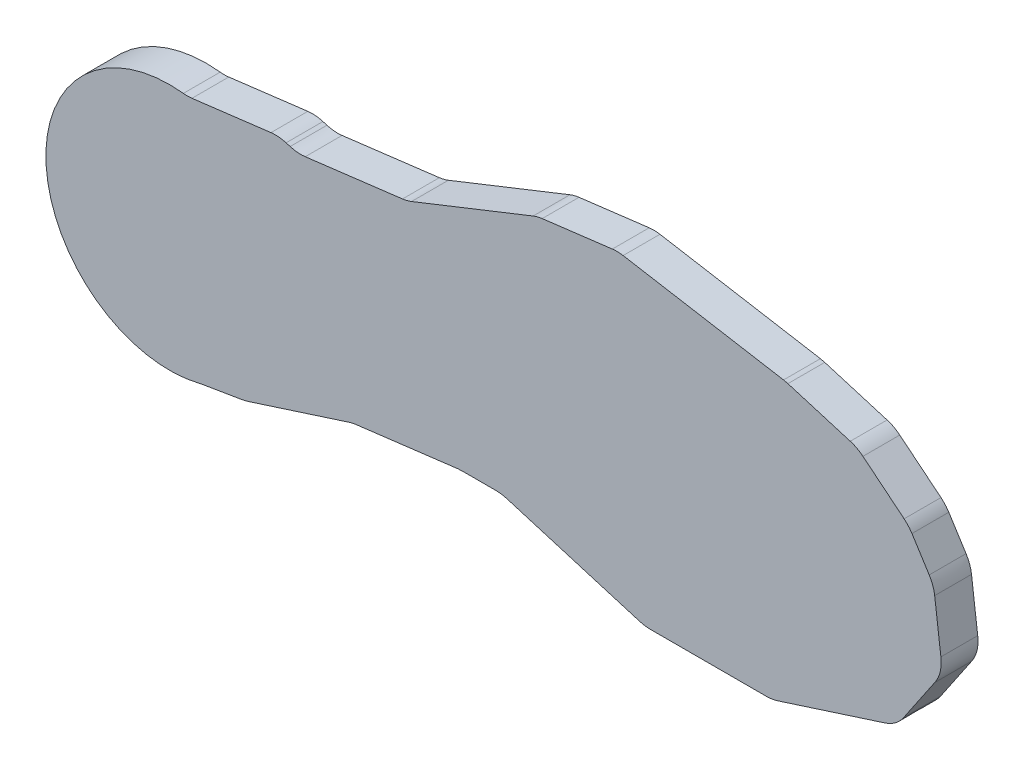
from build123d import *

# Parameters (mm, degrees)
BOSS_EXTRUDE1_DEPTH = 10


with BuildPart() as part:
    # Sketch1 → Boss-Extrude1 (new body)
    with BuildSketch(Plane.XY):
        with BuildLine():
            Line((52.492997883, 111.603009535), (77.278598509, 114.675604654))
            Line((77.278598509, 114.675604654), (82.399590374, 113.139307094))
            Line((82.399590374, 113.139307094), (112.164485784, 116.829170162))
            Line((112.164485784, 116.829170162), (147.538606895, 130.857938947))
            Line((147.538606895, 130.857938947), (169.32479305, 133.558705825))
            Line((169.32479305, 133.558705825), (214.930859836, 125.736947082))
            Line((214.930859836, 125.736947082), (234.343647346, 119.913110829))
            Line((234.343647346, 119.913110829), (248.319726795, 108.530414416))
            Line((248.319726795, 108.530414416), (255.079436056, 97.878751337))
            Line((255.079436056, 97.878751337), (257.499978125, 78.353045314))
            Line((257.499978125, 78.353045314), (245.042292001, 59.983411537))
            Line((245.042292001, 59.983411537), (211.243745693, 49.126908784))
            Line((211.243745693, 49.126908784), (176.692440436, 49.126908784))
            Line((176.692440436, 49.126908784), (137.730594207, 60.815462652))
            Line((137.730594207, 60.815462652), (126.440120412, 60.815462652))
            Line((126.440120412, 60.815462652), (97.282038079, 57.200824347))
            Line((97.282038079, 57.200824347), (68.151450621, 47.843726557))
            Line((68.151450621, 47.843726557), (56.180112026, 45.84947399))
            ThreePointArc((56.180112026, 45.84947399), (14.137584531, 76.472093888), (52.492997883, 111.603009535))
        make_face()
    extrude(amount=BOSS_EXTRUDE1_DEPTH)

    # Fillet1
    # a fillet whose section is not a circle: 10 mm, written as the material it adds along each edge
    with BuildSketch(Plane(origin=(52.492997883, 111.603009535, 0), x_dir=(0.992403542992036, 0.12302523260231585, 0), z_dir=(0, 0, 1))) as fillet1_piece_1:
        with BuildLine():
            Bezier((1.254512582, 0), (0.077754515, 0), (-1.066858149, 0.273169173), weights=[1, 1, 1])
            ThreePointArc((-1.066858149, 0.273169173), (-0.532309701, 0.140956283), (0, 0))
            Line((0, 0), (1.254512582, 0))
        make_face()
    extrude(amount=10)
    with BuildSketch(Plane(origin=(82.399590374, 113.139307094, 0), x_dir=(-0.9578262852211527, 0.2873478855663417, 0), z_dir=(0, 0, 1))) as fillet1_piece_2:
        with BuildLine():
            Bezier((2.104229523, 0), (0, 0), (-1.925789089, -0.848008414), weights=[1, 1, 1])
            Line((-1.925789089, -0.848008414), (0, 0))
            Line((0, 0), (2.104229523, 0))
        make_face()
    extrude(amount=10)
    with BuildSketch(Plane(origin=(112.164485784, 116.829170162, 0), x_dir=(-0.9924035429920363, -0.12302523260231377, 0), z_dir=(0, 0, 1))) as fillet1_piece_3:
        with BuildLine():
            Bezier((1.277987015, 0), (0, 0), (-1.2369124, -0.32140088), weights=[1, 1, 1])
            Line((-1.2369124, -0.32140088), (0, 0))
            Line((0, 0), (1.277987015, 0))
        make_face()
    extrude(amount=10)
    with BuildSketch(Plane(origin=(137.730594207, 60.815462652, 0), x_dir=(0.9578262852211517, -0.28734788556634455, 0), z_dir=(0, 0, 1))) as fillet1_piece_4:
        with BuildLine():
            Bezier((1.467688363, 0), (0, 0), (-1.405790493, -0.421737148), weights=[1, 1, 1])
            Line((-1.405790493, -0.421737148), (0, 0))
            Line((0, 0), (1.467688363, 0))
        make_face()
    extrude(amount=10)
    with BuildSketch(Plane(origin=(126.440120412, 60.815462652, 0), x_dir=(1, 0, 0), z_dir=(0, 0, 1))) as fillet1_piece_5:
        with BuildLine():
            Bezier((0.617471461, 0), (0, 0), (-0.612780865, -0.07596457), weights=[1, 1, 1])
            Line((-0.612780865, -0.07596457), (0, 0))
            Line((0, 0), (0.617471461, 0))
        make_face()
    extrude(amount=10)
    with BuildSketch(Plane(origin=(97.282038079, 57.200824347, 0), x_dir=(0.9924035429920361, 0.12302523260231554, 0), z_dir=(0, 0, 1))) as fillet1_piece_6:
        with BuildLine():
            Bezier((0.940076628, 0), (0, 0), (-0.923606439, -0.175200489), weights=[1, 1, 1])
            Line((-0.923606439, -0.175200489), (0, 0))
            Line((0, 0), (0.940076628, 0))
        make_face()
    extrude(amount=10)
    with BuildSketch(Plane(origin=(56.180112026, 45.84947399, 0), x_dir=(0.9864068887591122, 0.16432117881931246, 0), z_dir=(0, 0, 1))) as fillet1_piece_7:
        with BuildLine():
            Bezier((0.42414513, 0), (0.025948327, 0), (-0.370987708, -0.031661935), weights=[1, 1, 1])
            ThreePointArc((-0.370987708, -0.031661935), (-0.185449992, -0.016344913), (0, 0))
            Line((0, 0), (0.42414513, 0))
        make_face()
    extrude(amount=10)
    # a fillet whose section is not a circle: 10 mm, written as the material it takes off along each edge
    with BuildSketch(Plane(origin=(77.278598509, 114.675604654, -5.260573808), x_dir=(-0.9924035429920356, -0.12302523260232036, 0), z_dir=(0, 0, 1))) as fillet1_2_piece_1:
        with BuildLine():
            Bezier((2.104229523, 0), (0, 0), (-1.925789089, 0.848008414), weights=[1, 1, 1])
            Line((-1.925789089, 0.848008414), (0, 0))
            Line((0, 0), (2.104229523, 0))
        make_face()
    extrude(amount=20.521147616, mode=Mode.SUBTRACT)
    with BuildSketch(Plane(origin=(147.538606895, 130.857938947, -3.194967538), x_dir=(-0.9295679972504513, -0.36865069983357557, 0), z_dir=(0, 0, 1))) as fillet1_2_piece_2:
        with BuildLine():
            Bezier((1.277987015, 0), (0, 0), (-1.2369124, 0.32140088), weights=[1, 1, 1])
            Line((-1.2369124, 0.32140088), (0, 0))
            Line((0, 0), (1.277987015, 0))
        make_face()
    extrude(amount=16.389935077, mode=Mode.SUBTRACT)
    with BuildSketch(Plane(origin=(169.32479305, 133.558705825, -3.69138286), x_dir=(-0.9924035429920355, -0.12302523260232098, 0), z_dir=(0, 0, 1))) as fillet1_2_piece_3:
        with BuildLine():
            Bezier((1.476553144, 0), (0, 0), (-1.413543002, 0.426738055), weights=[1, 1, 1])
            Line((-1.413543002, 0.426738055), (0, 0))
            Line((0, 0), (1.476553144, 0))
        make_face()
    extrude(amount=17.382765719, mode=Mode.SUBTRACT)
    with BuildSketch(Plane(origin=(214.930859836, 125.736947082, -1.52190525), x_dir=(-0.9856093822774794, 0.1690388877347618, 0), z_dir=(0, 0, 1))) as fillet1_2_piece_4:
        with BuildLine():
            Bezier((0.6087621, 0), (0, 0), (-0.604266721, 0.073844597), weights=[1, 1, 1])
            Line((-0.604266721, 0.073844597), (0, 0))
            Line((0, 0), (0.6087621, 0))
        make_face()
    extrude(amount=13.0438105, mode=Mode.SUBTRACT)
    with BuildSketch(Plane(origin=(234.343647346, 119.913110829, -4.964089368), x_dir=(-0.9578262852211502, 0.2873478855663493, 0), z_dir=(0, 0, 1))) as fillet1_2_piece_5:
        with BuildLine():
            Bezier((1.985635747, 0), (0, 0), (-1.834997746, 0.758638644), weights=[1, 1, 1])
            Line((-1.834997746, 0.758638644), (0, 0))
            Line((0, 0), (1.985635747, 0))
        make_face()
    extrude(amount=19.928178736, mode=Mode.SUBTRACT)
    with BuildSketch(Plane(origin=(248.319726795, 108.530414416, -4.057930484), x_dir=(-0.7753767861991882, 0.6314988831529462, 0), z_dir=(0, 0, 1))) as fillet1_2_piece_6:
        with BuildLine():
            Bezier((1.623172194, 0), (0, 0), (-1.539836777, 0.513410821), weights=[1, 1, 1])
            Line((-1.539836777, 0.513410821), (0, 0))
            Line((0, 0), (1.623172194, 0))
        make_face()
    extrude(amount=18.115860969, mode=Mode.SUBTRACT)
    with BuildSketch(Plane(origin=(255.079436056, 97.878751337, -5.618661169), x_dir=(-0.5358244397314683, 0.8443294201829391, 0), z_dir=(0, 0, 1))) as fillet1_2_piece_7:
        with BuildLine():
            Bezier((2.247464468, 0), (0, 0), (-2.031338023, 0.961645656), weights=[1, 1, 1])
            Line((-2.031338023, 0.961645656), (0, 0))
            Line((0, 0), (2.247464468, 0))
        make_face()
    extrude(amount=21.237322338, mode=Mode.SUBTRACT)
    with BuildSketch(Plane(origin=(257.499978125, 78.353045314, -9.399513956), x_dir=(-0.1230252326023157, 0.9924035429920361, 0), z_dir=(0, 0, 1))) as fillet1_2_piece_8:
        with BuildLine():
            Bezier((3.759805582, 0), (0, 0), (-2.82847688, 2.477066118), weights=[1, 1, 1])
            Line((-2.82847688, 2.477066118), (0, 0))
            Line((0, 0), (3.759805582, 0))
        make_face()
    extrude(amount=28.799027912, mode=Mode.SUBTRACT)
    with BuildSketch(Plane(origin=(245.042292001, 59.983411537, -8.620030692), x_dir=(0.5612724167706503, 0.8276311220419598, 0), z_dir=(0, 0, 1))) as fillet1_2_piece_9:
        with BuildLine():
            Bezier((3.448012277, 0), (0, 0), (-2.715272388, 2.125108119), weights=[1, 1, 1])
            Line((-2.715272388, 2.125108119), (0, 0))
            Line((0, 0), (3.448012277, 0))
        make_face()
    extrude(amount=27.240061385, mode=Mode.SUBTRACT)
    with BuildSketch(Plane(origin=(211.243745693, 49.126908784, -3.916604957), x_dir=(0.9520885800773884, 0.3058223923884945, 0), z_dir=(0, 0, 1))) as fillet1_2_piece_10:
        with BuildLine():
            Bezier((1.566641983, 0), (0, 0), (-1.491581941, 0.479114199), weights=[1, 1, 1])
            Line((-1.491581941, 0.479114199), (0, 0))
            Line((0, 0), (1.566641983, 0))
        make_face()
    extrude(amount=17.833209914, mode=Mode.SUBTRACT)
    with BuildSketch(Plane(origin=(176.692440436, 49.126908784, -3.669220908), x_dir=(1, 0, 0), z_dir=(0, 0, 1))) as fillet1_2_piece_11:
        with BuildLine():
            Bezier((1.467688363, 0), (0, 0), (-1.405790493, 0.421737148), weights=[1, 1, 1])
            Line((-1.405790493, 0.421737148), (0, 0))
            Line((0, 0), (1.467688363, 0))
        make_face()
    extrude(amount=17.338441815, mode=Mode.SUBTRACT)
    with BuildSketch(Plane(origin=(68.151450621, 47.843726557, -1.824884502), x_dir=(0.9520885800773883, 0.30582239238849496, 0), z_dir=(0, 0, 1))) as fillet1_2_piece_12:
        with BuildLine():
            Bezier((0.729953801, 0), (0, 0), (-0.722216167, 0.106001699), weights=[1, 1, 1])
            Line((-0.722216167, 0.106001699), (0, 0))
            Line((0, 0), (0.729953801, 0))
        make_face()
    extrude(amount=13.649769005, mode=Mode.SUBTRACT)


solid = part.part
